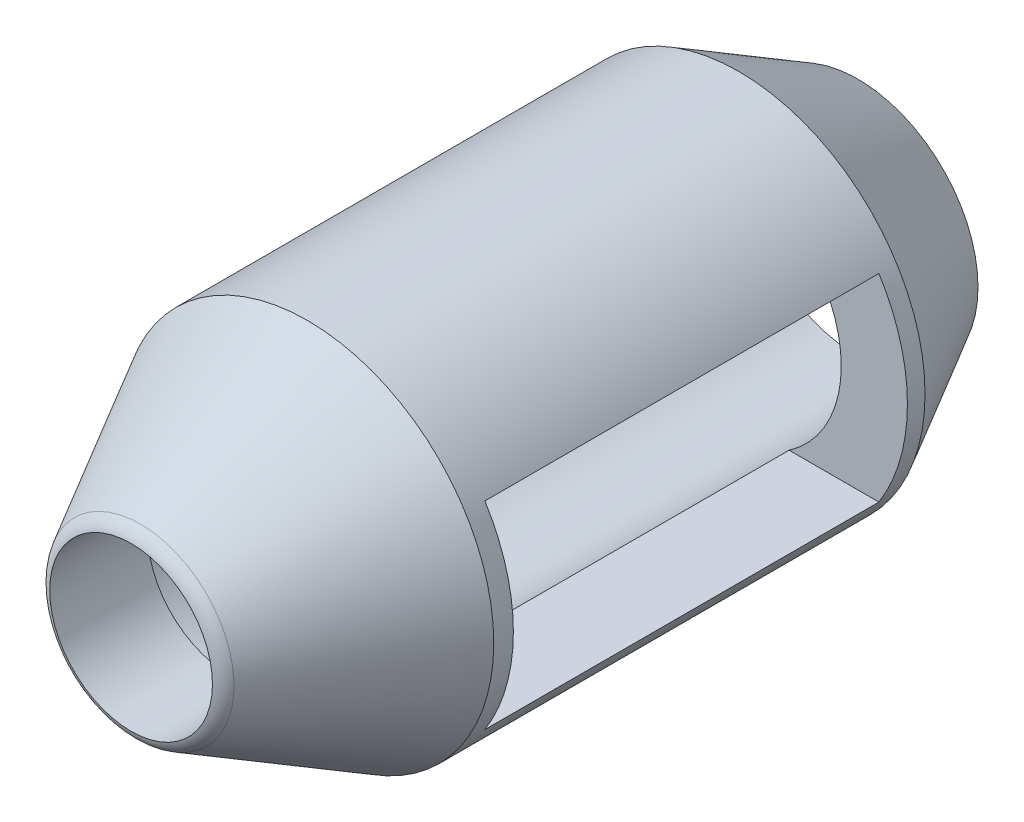
from build123d import *

# Parameters (mm, degrees)
SCHIZZO1_R                   = 9.5
SCHIZZO1_R_2                 = 4.15
ESTRUSIONE_ESTRUSIONE1_DEPTH = 40
SCHIZZO2_W                   = 20.1
SCHIZZO2_H                   = 10.1
TAGLIO_ESTRUSIONE1_DEPTH     = 46.290727528
SMUSSO1_SIZE                 = 9
SMUSSO1_SIZE2                = 5
RACCORDO1_R                  = 1
SCHIZZO3_R                   = 6.125
TAGLIO_ESTRUSIONE2_DEPTH     = 35


with BuildPart() as part:
    # Schizzo1 → Estrusione-Estrusione1 (new body)
    with BuildSketch(Plane.XY):
        Circle(SCHIZZO1_R)
        Circle(SCHIZZO1_R_2, mode=Mode.SUBTRACT)
    extrude(amount=ESTRUSIONE_ESTRUSIONE1_DEPTH)

    # Schizzo2 → Taglio-Estrusione1 (cut, through all)
    with BuildSketch(Plane(origin=(9.5, 0, 0), x_dir=(0, 0, -1), z_dir=(1, 0, 0))):
        with Locations((-19.95, 0)):
            Rectangle(SCHIZZO2_W, SCHIZZO2_H)
    extrude(amount=-TAGLIO_ESTRUSIONE1_DEPTH, mode=Mode.SUBTRACT)

    # Smusso1
    smusso1_edges = [part.edges().sort_by_distance(p)[0] for p in [
        (-9.5, 0, 0),
        (-9.5, 0, 40),
    ]]
    smusso1_side = [part.faces().sort_by_distance(p)[0] for p in [
        (-9.5, 0, 20),
    ]]
    chamfer(smusso1_edges, length=SMUSSO1_SIZE, length2=SMUSSO1_SIZE2, reference=smusso1_side[0])

    # Raccordo1
    # the kernel refuses this fillet: 1 mm, written as the material it takes off along each edge
    with BuildSketch(Plane(origin=(0, 0, 40), x_dir=(1, 0, 0), z_dir=(0, -1, 0))) as raccordo1_piece_1:
        with BuildLine():
            CenterArc((3.892925278, -0.966391529), RACCORDO1_R, 29.054604099, 46.048838888)
            Line((4.15, 0), (4.155141494, 0.019327831))
            ThreePointArc((4.155141494, 0.019327831), (4.325, 0.02), (4.5, 0.02))
            Line((4.5, 0.02), (4.517483146, 0.009712859))
            Line((4.517483146, 0.009712859), (4.7845657, -0.471035739))
            Line((4.7845657, -0.471035739), (4.767082554, -0.480748598))
        make_face()
    revolve(axis=Axis((0, 0, 40), (0, 0, 1)), mode=Mode.SUBTRACT)

    # Schizzo3 → Taglio-Estrusione2 (cut)
    with BuildSketch(Plane(origin=(0, 0, 0), x_dir=(-1, 0, 0), z_dir=(0, 0, -1))):
        Circle(SCHIZZO3_R)
    extrude(amount=-TAGLIO_ESTRUSIONE2_DEPTH, mode=Mode.SUBTRACT)


solid = part.part
